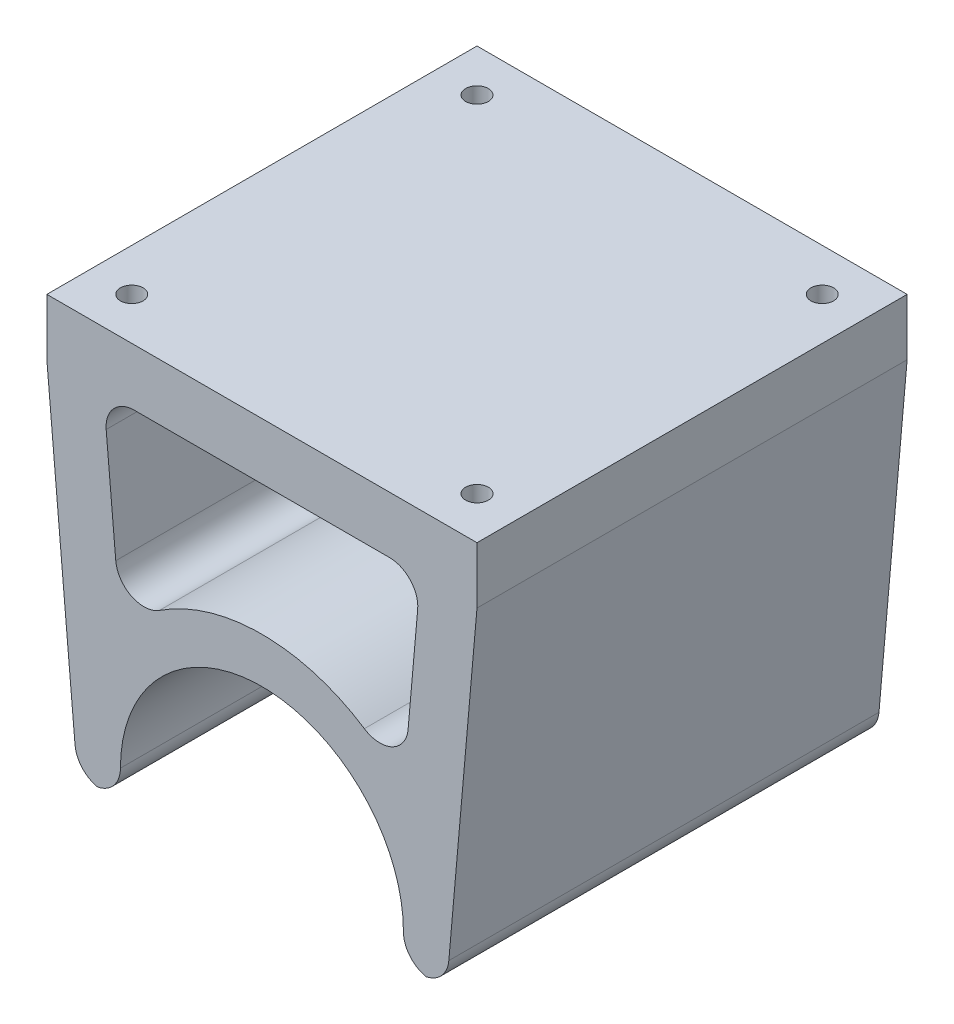
from build123d import *

# Parameters (mm, degrees)
SKETCH1_W                = 38
SKETCH1_H                = 38
BOSS_EXTRUDE1_DEPTH      = 5
F_2_0_2_DIAMETER_HOLE1_D = 2
BOSS_EXTRUDE3_START      = -19
BOSS_EXTRUDE3_DEPTH      = 38
BOSS_EXTRUDE4_START      = 19
BOSS_EXTRUDE4_DEPTH      = 38
FILLET5_START            = -20
FILLET5_DEPTH            = 40
FILLET5_START_2          = -19
FILLET5_2_DEPTH          = 38


with BuildPart() as part:
    # Sketch1 → Boss-Extrude1 (new body)
    with BuildSketch(Plane(origin=(0, 0, 0), x_dir=(1, 0, 0), z_dir=(0, 1, 0))):
        Rectangle(SKETCH1_W, SKETCH1_H)
    extrude(amount=BOSS_EXTRUDE1_DEPTH)

    # Ø2.0 (2) Diameter Hole1 (through all)
    with Locations(Plane(origin=(0, 5, 0), x_dir=(1, 0, 0), z_dir=(0, 1, 0))):
        with Locations((-15.25, 15.25), (15.25, 15.25), (15.25, -15.25), (-15.25, -15.25)):
            Hole(F_2_0_2_DIAMETER_HOLE1_D / 2)



with BuildPart() as body_2:
    # Sketch10 → Boss-Extrude3 (new body)
    with BuildSketch(Plane.XY.offset(BOSS_EXTRUDE3_START)):
        with BuildLine():
            Line((-12.247448714, -30.5), (-16.30950643, -30.5))
            ThreePointArc((-16.30950643, -30.5), (0, -11.5), (16.30950643, -30.5))
            Line((16.30950643, -30.5), (12.247448714, -30.5))
            ThreePointArc((12.247448714, -30.5), (0, -15.5), (-12.247448714, -30.5))
        make_face()
    extrude(amount=BOSS_EXTRUDE3_DEPTH)


with BuildPart() as part_1:
    add(part.part)

    add(body_2.part)  # Boss-Extrude4 merges body 2
    # Sketch11 → Boss-Extrude4 (add)
    with BuildSketch(Plane.XY.offset(BOSS_EXTRUDE4_START)):
        Polygon((-19, 0), (-16.30950643, -30.5), (-12.481964126, -17.208773398), (-14, 0), align=None)
    boss_extrude4 = extrude(amount=-BOSS_EXTRUDE4_DEPTH)

    # Mirror1: Boss-Extrude4 across plane
    add(boss_extrude4.mirror(Plane(origin=(0, 0, 0), x_dir=(0, 0, 1), z_dir=(1, 0, 0))))

    # Fillet5: read off the stored shape, not the designer's step
    # Fillet5 outline → Fillet5 (cut)
    with BuildSketch(Plane.XY.offset(FILLET5_START)):
        with BuildLine():
            ThreePointArc((16.51066015, -28.219679197), (15.881955848, -29.668637648), (14.510165322, -30.451542777))
            ThreePointArc((14.510165322, -30.451542777), (13.066791954, -29.585151934), (12.5, -28))
            ThreePointArc((12.5, -28), (12.436701913, -29.256362025), (12.247448714, -30.5))
            Line((12.247448714, -30.5), (16.30950643, -30.5))
            ThreePointArc((16.30950643, -30.5), (16.436174742, -29.449882703), (16.495299812, -28.393807221))
            Line((16.495299812, -28.393807221), (16.51066015, -28.219679197))
        make_face()
        with BuildLine():
            ThreePointArc((-12.247448714, -30.5), (-12.436701913, -29.256362025), (-12.5, -28))
            ThreePointArc((-12.5, -28), (-13.066791954, -29.585151934), (-14.510165322, -30.451542777))
            ThreePointArc((-14.510165322, -30.451542777), (-15.881955848, -29.668637648), (-16.51066015, -28.219679197))
            Line((-16.51066015, -28.219679197), (-16.495299812, -28.393807221))
            ThreePointArc((-16.495299812, -28.393807221), (-16.436174742, -29.449882703), (-16.30950643, -30.5))
            Line((-16.30950643, -30.5), (-12.247448714, -30.5))
        make_face()
    extrude(amount=FILLET5_DEPTH, mode=Mode.SUBTRACT)

    # Fillet5 2 outline → Fillet5 2 (add)
    with BuildSketch(Plane.XY.offset(FILLET5_START_2)):
        with BuildLine():
            Line((12.481964126, -17.208773398), (12.912072208, -12.33297787))
            ThreePointArc((12.912072208, -12.33297787), (11.511662087, -14.363204389), (9.050460767, -14.203654111))
            ThreePointArc((9.050460767, -14.203654111), (10.870557296, -15.587063841), (12.481964126, -17.208773398))
        make_face()
        with BuildLine():
            ThreePointArc((11.269759694, 0), (13.113559845, -0.811686936), (13.7600892, -2.719679197))
            Line((13.7600892, -2.719679197), (14, 0))
            Line((14, 0), (11.269759694, 0))
        make_face()
        with BuildLine():
            ThreePointArc((-12.481964126, -17.208773398), (-10.870557296, -15.587063841), (-9.050460767, -14.20365411))
            ThreePointArc((-9.050460767, -14.20365411), (-11.511662087, -14.363204389), (-12.912072208, -12.33297787))
            Line((-12.912072208, -12.33297787), (-12.481964126, -17.208773398))
        make_face()
        with BuildLine():
            ThreePointArc((-13.7600892, -2.719679197), (-13.113559845, -0.811686936), (-11.269759694, 0))
            Line((-11.269759694, 0), (-14, 0))
            Line((-14, 0), (-13.7600892, -2.719679197))
        make_face()
    extrude(amount=FILLET5_2_DEPTH)


solid = part_1.part
